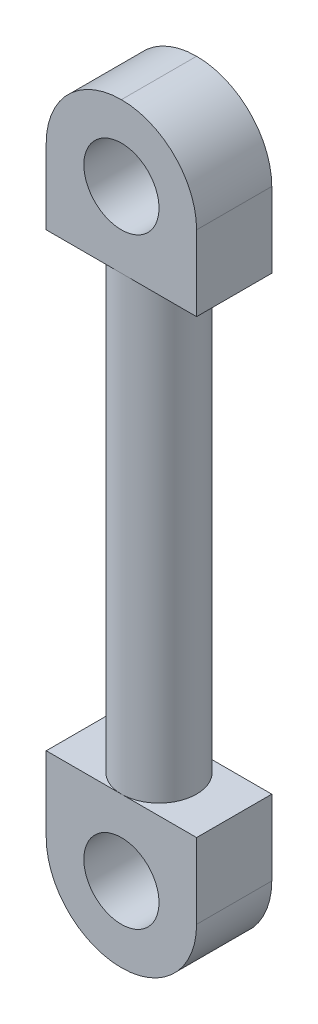
from build123d import *

# Parameters (mm, degrees)
SKETCH1_R           = 1.5875
BOSS_EXTRUDE1_DEPTH = 9.525
SKETCH2_W           = 6.35
SKETCH2_H           = 3.175
BOSS_EXTRUDE2_DEPTH = 6.35
SKETCH3_R           = 1.5875
CUT_EXTRUDE1_DEPTH  = 17.497783942
FILLET1_R           = 3.175


with BuildPart() as part:
    # Sketch1 → Boss-Extrude1 (new body)
    with BuildSketch(Plane(origin=(0, 0, 0), x_dir=(1, 0, 0), z_dir=(0, 1, 0))):
        with Locations(Location((0, 0, 0), (0, 0, 90))):
            Circle(SKETCH1_R)
    boss_extrude1 = extrude(amount=BOSS_EXTRUDE1_DEPTH)

    # Sketch2 → Boss-Extrude2 (add)
    with BuildSketch(Plane(origin=(0, 9.525, 0), x_dir=(1, 0, 0), z_dir=(0, 1, 0))):
        Rectangle(SKETCH2_W, SKETCH2_H)
    boss_extrude2 = extrude(amount=BOSS_EXTRUDE2_DEPTH)

    # Sketch3 → Cut-Extrude1 (cut, through all)
    with BuildSketch(Plane(origin=(0, 0, -1.5875), x_dir=(-1, 0, 0), z_dir=(0, 0, -1))):
        with Locations((0, 12.7)):
            Circle(SKETCH3_R)
    cut_extrude1 = extrude(amount=-CUT_EXTRUDE1_DEPTH, mode=Mode.SUBTRACT)

    # Mirror1: Boss-Extrude1, Boss-Extrude2, Cut-Extrude1 across plane
    add(boss_extrude1.mirror(Plane.ZX))
    add(boss_extrude2.mirror(Plane.ZX))
    add(cut_extrude1.mirror(Plane.ZX), mode=Mode.SUBTRACT)

    # Fillet1
    fillet1_edges = [part.edges().sort_by_distance(p)[0] for p in [
        (-3.175, -15.875, 0),
        (3.175, -15.875, 0),
        (-3.175, 15.875, 0),
        (3.175, 15.875, 0),
    ]]
    fillet(fillet1_edges, radius=FILLET1_R - 0.0001)  # a hair under: the kernel refuses the full size


solid = part.part
